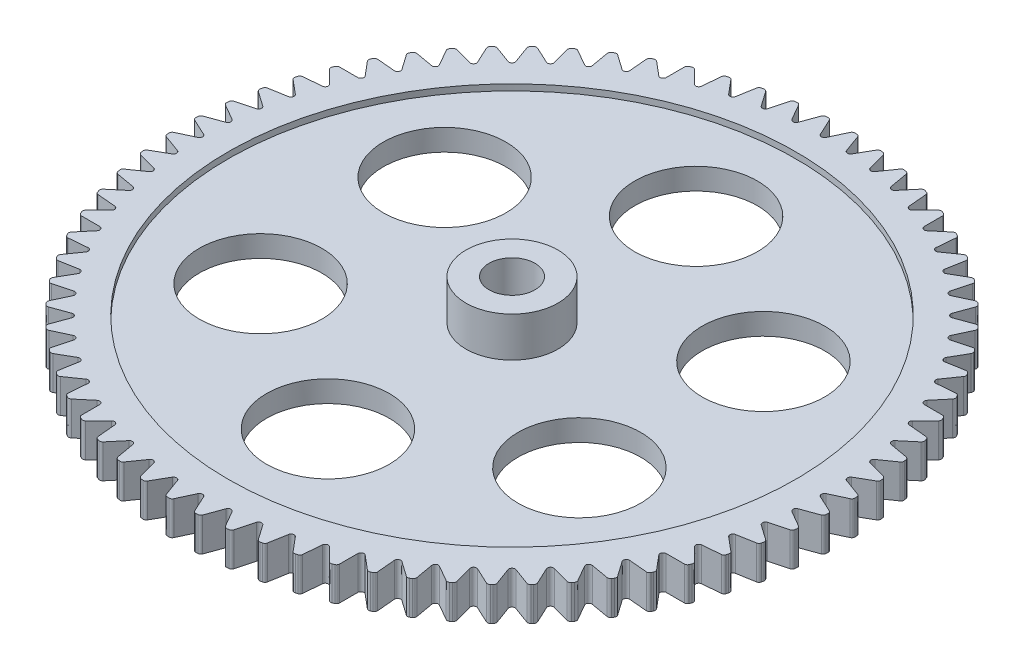
from build123d import *

# Parameters (mm, degrees)
CUT_EXTRUDE1_DEPTH = 16.321063932
FILLET1_R          = 0.1
CIRPATTERN1_START  = 0.8
CIRPATTERN1_DEPTH  = 1.1
SKETCH3_R          = 2
CUT_EXTRUDE2_DEPTH = 16.285192352
CIRPATTERN2_COUNT  = 6


# Read off the part's stored shape, not the designer's step: CirPattern1
with BuildPart() as part:
    # Sketch1 → Revolve1 (revolve)
    with BuildSketch(Plane.XY, mode=Mode.PRIVATE) as revolve1_sk:
        Polygon((0.5, 0), (0.5, 0.5), (0.75, 0.5), (0.75, 3), (1.5, 3), (1.5, 1.7), (9.25, 1.7), (9.25, 1.9), (10.75, 1.9), (10.75, 0.8), (9.25, 0.8), (9.25, 1), (1.5, 1), (1.5, 0), align=None)
    revolve(revolve1_sk.sketch.rotate(Axis((0, 55, 0), (0, -1, 0)), 90), axis=Axis((0, 55, 0), (0, -1, 0)))

    # Sketch2 → Cut-Extrude1 (cut, through all)
    with BuildSketch(Plane(origin=(0, 1.9, 0), x_dir=(1, 0, 0), z_dir=(0, 1, 0))):
        Polygon((-0.373046127, 10.75), (0, 9.95), (0.373046127, 10.75), align=None)
    extrude(amount=-CUT_EXTRUDE1_DEPTH, mode=Mode.SUBTRACT)

    # Fillet1
    fillet1_edges = [part.edges().sort_by_distance(p)[0] for p in [
        (0.370074857, 1.35, -10.743628093),
        (-0.370074857, 1.35, -10.743628093),
        (0, 1.35, -9.95),
    ]]
    fillet(fillet1_edges, radius=FILLET1_R)

    # CirPattern1 outline → CirPattern1 (cut)
    with BuildSketch(Plane(origin=(0, 0, 0), x_dir=(1, 0, 0), z_dir=(0, 1, 0)).offset(CIRPATTERN1_START)):
        with BuildLine():
            ThreePointArc((-7.947463997, -7.238806256), (-7.972392938, -7.186532724), (-7.964164878, -7.129206697))
            Line((-7.964164878, -7.129206697), (-7.712772988, -6.590095049))
            ThreePointArc((-7.712772988, -6.590095049), (-7.726799322, -6.483554461), (-7.829285671, -6.45124064))
            Line((-7.829285671, -6.45124064), (-8.403860746, -6.605197567))
            ThreePointArc((-8.403860746, -6.605197567), (-8.461744649, -6.603346064), (-8.508895164, -6.569718646))
            ThreePointArc((-8.508895164, -6.569718646), (-8.234977764, -6.909966804), (-7.947463997, -7.238806256))
        make_face()
        with BuildLine():
            ThreePointArc((1.271846931, 10.613006913), (1.314086242, 10.652627802), (1.371204865, 10.662190076))
            ThreePointArc((1.371204865, 10.662190076), (0.936924234, 10.709093004), (0.501096694, 10.738314677))
            ThreePointArc((0.501096694, 10.738314677), (0.555687086, 10.718979131), (0.590404592, 10.672625392))
            Line((0.590404592, 10.672625392), (0.793853184, 10.113654979))
            ThreePointArc((0.793853184, 10.113654979), (0.879106871, 10.048237523), (0.974424986, 10.097856993))
            Line((0.974424986, 10.097856993), (1.271846931, 10.613006913))
        make_face()
        with BuildLine():
            ThreePointArc((2.19199167, 10.461772453), (2.237523435, 10.497561175), (2.295258112, 10.502108845))
            ThreePointArc((2.295258112, 10.502108845), (1.86671791, 10.586683345), (1.435095662, 10.653778693))
            ThreePointArc((1.435095662, 10.653778693), (1.487793117, 10.629758858), (1.518338517, 10.58055568))
            Line((1.518338517, 10.58055568), (1.672295444, 10.005980604))
            ThreePointArc((1.672295444, 10.005980604), (1.75152321, 9.933381734), (1.850803232, 9.974504865))
            Line((1.850803232, 9.974504865), (2.19199167, 10.461772453))
        make_face()
        with BuildLine():
            ThreePointArc((3.095454028, 10.230917588), (3.143931724, 10.262601768), (3.201843059, 10.262100225))
            ThreePointArc((3.201843059, 10.262100225), (2.782304735, 10.383702632), (2.358172684, 10.48816102))
            ThreePointArc((2.358172684, 10.48816102), (2.408576143, 10.459639702), (2.43471697, 10.40796155))
            Line((2.43471697, 10.40796155), (2.538010527, 9.822154676))
            ThreePointArc((2.538010527, 9.822154676), (2.610609398, 9.742926911), (2.713095747, 9.775240733))
            Line((2.713095747, 9.775240733), (3.095454028, 10.230917588))
        make_face()
        with BuildLine():
            ThreePointArc((3.975358112, 9.922199263), (4.026412794, 9.949537766), (4.084060047, 9.943990825))
            ThreePointArc((4.084060047, 9.943990825), (3.676716541, 10.101695673), (3.263302589, 10.242722109))
            ThreePointArc((3.263302589, 10.242722109), (3.311028451, 10.209916373), (3.332565756, 10.156156548))
            Line((3.332565756, 10.156156548), (3.384409817, 9.563576219))
            ThreePointArc((3.384409817, 9.563576219), (3.449827272, 9.478322531), (3.554739965, 9.501581115))
            Line((3.554739965, 9.501581115), (3.975358112, 9.922199263))
        make_face()
        with BuildLine():
            ThreePointArc((4.825007321, 9.53796701), (4.878250432, 9.560751773), (4.935194872, 9.550201651))
            ThreePointArc((4.935194872, 9.550201651), (4.543146314, 9.74280871), (4.143596791, 9.919329898))
            ThreePointArc((4.143596791, 9.919329898), (4.188281833, 9.882489415), (4.205051704, 9.827057062))
            Line((4.205051704, 9.827057062), (4.205051704, 9.232213173))
            ThreePointArc((4.205051704, 9.232213173), (4.262789878, 9.141582394), (4.369330465, 9.155608729))
            Line((4.369330465, 9.155608729), (4.825007321, 9.53796701))
        make_face()
        with BuildLine():
            ThreePointArc((5.637935311, 9.08114507), (5.692961638, 9.099202686), (5.748769883, 9.083729676))
            ThreePointArc((5.748769883, 9.083729676), (5.375, 9.309773091), (4.992355719, 9.520445597))
            ThreePointArc((4.992355719, 9.520445597), (5.033659861, 9.479850745), (5.04553467, 9.423167739))
            Line((5.04553467, 9.423167739), (4.993690609, 8.83058741))
            ThreePointArc((4.993690609, 8.83058741), (5.043310079, 8.735269295), (5.150667723, 8.739956631))
            Line((5.150667723, 8.739956631), (5.637935311, 9.08114507))
        make_face()
        with BuildLine():
            ThreePointArc((6.407955208, 8.555210131), (6.464345969, 8.568403173), (6.518593285, 8.548125033))
            ThreePointArc((6.518593285, 8.548125033), (6.16594669, 8.805884476), (5.803119805, 9.049104957))
            ThreePointArc((5.803119805, 9.049104957), (5.840728699, 9.005064687), (5.847618071, 8.947562419))
            Line((5.847618071, 8.947562419), (5.744324514, 8.361755545))
            ThreePointArc((5.744324514, 8.361755545), (5.785447645, 8.262475523), (5.892805289, 8.257788187))
            Line((5.892805289, 8.257788187), (6.407955208, 8.555210131))
        make_face()
        with BuildLine():
            ThreePointArc((7.129206697, 7.964164878), (7.186532724, 7.972392938), (7.238806256, 7.947463997))
            ThreePointArc((7.238806256, 7.947463997), (6.909966804, 8.234977763), (6.569718646, 8.508895164))
            ThreePointArc((6.569718646, 8.508895164), (6.603346064, 8.461744649), (6.605197567, 8.403860746))
            Line((6.605197567, 8.403860746), (6.45124064, 7.829285671))
            ThreePointArc((6.45124064, 7.829285671), (6.483554461, 7.726799322), (6.590095049, 7.712772988))
            Line((6.590095049, 7.712772988), (7.129206697, 7.964164878))
        make_face()
        with BuildLine():
            ThreePointArc((7.796200619, 7.312507521), (7.854025625, 7.315707978), (7.903927541, 7.286317961))
            ThreePointArc((7.903927541, 7.286317961), (7.601397898, 7.601397898), (7.286317961, 7.903927541))
            ThreePointArc((7.286317961, 7.903927541), (7.315707978, 7.854025625), (7.312507521, 7.796200619))
            Line((7.312507521, 7.796200619), (7.109058929, 7.237230206))
            ThreePointArc((7.109058929, 7.237230206), (7.132317513, 7.132317513), (7.237230206, 7.109058929))
            Line((7.237230206, 7.109058929), (7.796200619, 7.312507521))
        make_face()
        with BuildLine():
            ThreePointArc((8.403860746, 6.605197567), (8.461744649, 6.603346064), (8.508895164, 6.569718646))
            ThreePointArc((8.508895164, 6.569718646), (8.234977763, 6.909966804), (7.947463997, 7.238806256))
            ThreePointArc((7.947463997, 7.238806256), (7.972392938, 7.186532724), (7.964164878, 7.129206697))
            Line((7.964164878, 7.129206697), (7.712772988, 6.590095049))
            ThreePointArc((7.712772988, 6.590095049), (7.726799322, 6.483554461), (7.829285671, 6.45124064))
            Line((7.829285671, 6.45124064), (8.403860746, 6.605197567))
        make_face()
        with BuildLine():
            ThreePointArc((8.947562419, 5.847618071), (9.005064687, 5.840728699), (9.049104957, 5.803119805))
            ThreePointArc((9.049104957, 5.803119805), (8.805884476, 6.16594669), (8.548125033, 6.518593285))
            ThreePointArc((8.548125033, 6.518593285), (8.568403173, 6.464345969), (8.555210131, 6.407955208))
            Line((8.555210131, 6.407955208), (8.257788187, 5.892805289))
            ThreePointArc((8.257788187, 5.892805289), (8.262475523, 5.785447645), (8.361755545, 5.744324514))
            Line((8.361755545, 5.744324514), (8.947562419, 5.847618071))
        make_face()
        with BuildLine():
            ThreePointArc((9.423167739, 5.04553467), (9.479850745, 5.033659861), (9.520445598, 4.992355719))
            ThreePointArc((9.520445598, 4.992355719), (9.309773091, 5.375), (9.083729676, 5.748769883))
            ThreePointArc((9.083729676, 5.748769883), (9.099202686, 5.692961638), (9.08114507, 5.637935311))
            Line((9.08114507, 5.637935311), (8.739956631, 5.150667723))
            ThreePointArc((8.739956631, 5.150667723), (8.735269295, 5.043310079), (8.83058741, 4.993690609))
            Line((8.83058741, 4.993690609), (9.423167739, 5.04553467))
        make_face()
        with BuildLine():
            ThreePointArc((9.827057062, 4.205051704), (9.882489415, 4.188281833), (9.919329899, 4.143596791))
            ThreePointArc((9.919329899, 4.143596791), (9.74280871, 4.543146314), (9.550201651, 4.935194872))
            ThreePointArc((9.550201651, 4.935194872), (9.560751773, 4.878250432), (9.53796701, 4.825007321))
            Line((9.53796701, 4.825007321), (9.155608729, 4.369330465))
            ThreePointArc((9.155608729, 4.369330465), (9.141582394, 4.262789878), (9.232213173, 4.205051704))
            Line((9.232213173, 4.205051704), (9.827057062, 4.205051704))
        make_face()
        with BuildLine():
            ThreePointArc((10.156156548, 3.332565756), (10.209916373, 3.311028451), (10.242722109, 3.263302589))
            ThreePointArc((10.242722109, 3.263302589), (10.101695673, 3.676716541), (9.943990825, 4.084060047))
            ThreePointArc((9.943990825, 4.084060047), (9.949537766, 4.026412794), (9.922199263, 3.975358112))
            Line((9.922199263, 3.975358112), (9.501581115, 3.554739965))
            ThreePointArc((9.501581115, 3.554739965), (9.478322531, 3.449827272), (9.563576219, 3.384409817))
            Line((9.563576219, 3.384409817), (10.156156548, 3.332565756))
        make_face()
        with BuildLine():
            ThreePointArc((10.40796155, 2.43471697), (10.459639702, 2.408576143), (10.48816102, 2.358172684))
            ThreePointArc((10.48816102, 2.358172684), (10.383702632, 2.782304735), (10.262100225, 3.201843059))
            ThreePointArc((10.262100225, 3.201843059), (10.262601768, 3.143931724), (10.230917588, 3.095454028))
            Line((10.230917588, 3.095454028), (9.775240733, 2.713095747))
            ThreePointArc((9.775240733, 2.713095747), (9.742926911, 2.610609398), (9.822154676, 2.538010527))
            Line((9.822154676, 2.538010527), (10.40796155, 2.43471697))
        make_face()
        with BuildLine():
            ThreePointArc((10.58055568, 1.518338517), (10.629758858, 1.487793117), (10.653778693, 1.435095662))
            ThreePointArc((10.653778693, 1.435095662), (10.586683345, 1.86671791), (10.502108845, 2.295258112))
            ThreePointArc((10.502108845, 2.295258112), (10.497561175, 2.237523435), (10.461772453, 2.19199167))
            Line((10.461772453, 2.19199167), (9.974504865, 1.850803232))
            ThreePointArc((9.974504865, 1.850803232), (9.933381734, 1.75152321), (10.005980604, 1.672295444))
            Line((10.005980604, 1.672295444), (10.58055568, 1.518338517))
        make_face()
        with BuildLine():
            ThreePointArc((10.672625392, 0.590404592), (10.718979131, 0.555687086), (10.738314677, 0.501096694))
            ThreePointArc((10.738314677, 0.501096694), (10.709093004, 0.936924234), (10.662190076, 1.371204865))
            ThreePointArc((10.662190076, 1.371204865), (10.652627802, 1.314086242), (10.613006913, 1.271846931))
            Line((10.613006913, 1.271846931), (10.097856993, 0.974424986))
            ThreePointArc((10.097856993, 0.974424986), (10.048237523, 0.879106871), (10.113654979, 0.793853184))
            Line((10.113654979, 0.793853184), (10.672625392, 0.590404592))
        make_face()
        with BuildLine():
            ThreePointArc((10.683469981, -0.342022669), (10.7266215, -0.380648058), (10.741125602, -0.436715922))
            ThreePointArc((10.741125602, -0.436715922), (10.75, 0), (10.741125602, 0.436715922))
            ThreePointArc((10.741125602, 0.436715922), (10.7266215, 0.380648058), (10.683469981, 0.342022669))
            Line((10.683469981, 0.342022669), (10.144358332, 0.090630779))
            ThreePointArc((10.144358332, 0.090630779), (10.086620158, 0), (10.144358332, -0.090630779))
            Line((10.144358332, -0.090630779), (10.683469981, -0.342022669))
        make_face()
        with BuildLine():
            ThreePointArc((10.613006913, -1.271846931), (10.652627802, -1.314086242), (10.662190076, -1.371204865))
            ThreePointArc((10.662190076, -1.371204865), (10.709093004, -0.936924234), (10.738314677, -0.501096694))
            ThreePointArc((10.738314677, -0.501096694), (10.718979131, -0.555687086), (10.672625392, -0.590404592))
            Line((10.672625392, -0.590404592), (10.113654979, -0.793853184))
            ThreePointArc((10.113654979, -0.793853184), (10.048237523, -0.879106871), (10.097856993, -0.974424986))
            Line((10.097856993, -0.974424986), (10.613006913, -1.271846931))
        make_face()
        with BuildLine():
            ThreePointArc((10.461772453, -2.19199167), (10.497561175, -2.237523435), (10.502108845, -2.295258112))
            ThreePointArc((10.502108845, -2.295258112), (10.586683345, -1.86671791), (10.653778693, -1.435095662))
            ThreePointArc((10.653778693, -1.435095662), (10.629758858, -1.487793117), (10.58055568, -1.518338517))
            Line((10.58055568, -1.518338517), (10.005980604, -1.672295444))
            ThreePointArc((10.005980604, -1.672295444), (9.933381734, -1.75152321), (9.974504865, -1.850803232))
            Line((9.974504865, -1.850803232), (10.461772453, -2.19199167))
        make_face()
        with BuildLine():
            ThreePointArc((10.230917588, -3.095454028), (10.262601768, -3.143931724), (10.262100225, -3.201843059))
            ThreePointArc((10.262100225, -3.201843059), (10.383702633, -2.782304735), (10.48816102, -2.358172684))
            ThreePointArc((10.48816102, -2.358172684), (10.459639702, -2.408576143), (10.40796155, -2.43471697))
            Line((10.40796155, -2.43471697), (9.822154676, -2.538010527))
            ThreePointArc((9.822154676, -2.538010527), (9.742926911, -2.610609398), (9.775240733, -2.713095747))
            Line((9.775240733, -2.713095747), (10.230917588, -3.095454028))
        make_face()
        with BuildLine():
            ThreePointArc((9.922199263, -3.975358112), (9.949537766, -4.026412794), (9.943990825, -4.084060047))
            ThreePointArc((9.943990825, -4.084060047), (10.101695673, -3.676716541), (10.242722109, -3.263302589))
            ThreePointArc((10.242722109, -3.263302589), (10.209916373, -3.311028451), (10.156156548, -3.332565756))
            Line((10.156156548, -3.332565756), (9.563576219, -3.384409817))
            ThreePointArc((9.563576219, -3.384409817), (9.478322531, -3.449827272), (9.501581115, -3.554739965))
            Line((9.501581115, -3.554739965), (9.922199263, -3.975358112))
        make_face()
        with BuildLine():
            ThreePointArc((9.53796701, -4.825007321), (9.560751773, -4.878250432), (9.550201651, -4.935194872))
            ThreePointArc((9.550201651, -4.935194872), (9.74280871, -4.543146314), (9.919329898, -4.143596791))
            ThreePointArc((9.919329898, -4.143596791), (9.882489415, -4.188281833), (9.827057062, -4.205051704))
            Line((9.827057062, -4.205051704), (9.232213173, -4.205051704))
            ThreePointArc((9.232213173, -4.205051704), (9.141582394, -4.262789878), (9.155608729, -4.369330465))
            Line((9.155608729, -4.369330465), (9.53796701, -4.825007321))
        make_face()
        with BuildLine():
            ThreePointArc((9.08114507, -5.637935311), (9.099202686, -5.692961638), (9.083729676, -5.748769883))
            ThreePointArc((9.083729676, -5.748769883), (9.309773091, -5.375), (9.520445598, -4.992355719))
            ThreePointArc((9.520445598, -4.992355719), (9.479850745, -5.033659861), (9.423167739, -5.04553467))
            Line((9.423167739, -5.04553467), (8.83058741, -4.993690609))
            ThreePointArc((8.83058741, -4.993690609), (8.735269295, -5.043310079), (8.739956631, -5.150667723))
            Line((8.739956631, -5.150667723), (9.08114507, -5.637935311))
        make_face()
        with BuildLine():
            ThreePointArc((8.555210131, -6.407955208), (8.568403173, -6.464345969), (8.548125033, -6.518593285))
            ThreePointArc((8.548125033, -6.518593285), (8.805884476, -6.165946691), (9.049104957, -5.803119805))
            ThreePointArc((9.049104957, -5.803119805), (9.005064687, -5.840728699), (8.947562419, -5.847618071))
            Line((8.947562419, -5.847618071), (8.361755545, -5.744324514))
            ThreePointArc((8.361755545, -5.744324514), (8.262475523, -5.785447645), (8.257788187, -5.892805289))
            Line((8.257788187, -5.892805289), (8.555210131, -6.407955208))
        make_face()
        with BuildLine():
            ThreePointArc((7.964164878, -7.129206697), (7.972392938, -7.186532724), (7.947463997, -7.238806256))
            ThreePointArc((7.947463997, -7.238806256), (8.234977764, -6.909966804), (8.508895164, -6.569718646))
            ThreePointArc((8.508895164, -6.569718646), (8.461744649, -6.603346064), (8.403860746, -6.605197567))
            Line((8.403860746, -6.605197567), (7.829285671, -6.45124064))
            ThreePointArc((7.829285671, -6.45124064), (7.726799322, -6.483554461), (7.712772988, -6.590095049))
            Line((7.712772988, -6.590095049), (7.964164878, -7.129206697))
        make_face()
        with BuildLine():
            ThreePointArc((7.312507521, -7.796200619), (7.315707978, -7.854025625), (7.286317961, -7.903927541))
            ThreePointArc((7.286317961, -7.903927541), (7.601397898, -7.601397898), (7.903927541, -7.286317961))
            ThreePointArc((7.903927541, -7.286317961), (7.854025625, -7.315707978), (7.796200619, -7.312507521))
            Line((7.796200619, -7.312507521), (7.237230206, -7.109058929))
            ThreePointArc((7.237230206, -7.109058929), (7.132317513, -7.132317513), (7.109058929, -7.237230206))
            Line((7.109058929, -7.237230206), (7.312507521, -7.796200619))
        make_face()
        with BuildLine():
            ThreePointArc((6.605197567, -8.403860746), (6.603346064, -8.461744649), (6.569718646, -8.508895164))
            ThreePointArc((6.569718646, -8.508895164), (6.909966804, -8.234977764), (7.238806256, -7.947463997))
            ThreePointArc((7.238806256, -7.947463997), (7.186532724, -7.972392938), (7.129206697, -7.964164878))
            Line((7.129206697, -7.964164878), (6.590095049, -7.712772988))
            ThreePointArc((6.590095049, -7.712772988), (6.483554461, -7.726799322), (6.45124064, -7.829285671))
            Line((6.45124064, -7.829285671), (6.605197567, -8.403860746))
        make_face()
        with BuildLine():
            ThreePointArc((5.847618071, -8.947562419), (5.840728699, -9.005064687), (5.803119805, -9.049104957))
            ThreePointArc((5.803119805, -9.049104957), (6.165946691, -8.805884476), (6.518593285, -8.548125033))
            ThreePointArc((6.518593285, -8.548125033), (6.464345969, -8.568403173), (6.407955208, -8.555210131))
            Line((6.407955208, -8.555210131), (5.892805289, -8.257788187))
            ThreePointArc((5.892805289, -8.257788187), (5.785447645, -8.262475523), (5.744324514, -8.361755545))
            Line((5.744324514, -8.361755545), (5.847618071, -8.947562419))
        make_face()
        with BuildLine():
            ThreePointArc((5.04553467, -9.423167739), (5.033659861, -9.479850745), (4.992355719, -9.520445598))
            ThreePointArc((4.992355719, -9.520445598), (5.375, -9.309773091), (5.748769883, -9.083729676))
            ThreePointArc((5.748769883, -9.083729676), (5.692961638, -9.099202686), (5.637935311, -9.08114507))
            Line((5.637935311, -9.08114507), (5.150667723, -8.739956631))
            ThreePointArc((5.150667723, -8.739956631), (5.043310079, -8.735269295), (4.993690609, -8.83058741))
            Line((4.993690609, -8.83058741), (5.04553467, -9.423167739))
        make_face()
        with BuildLine():
            ThreePointArc((4.205051704, -9.827057062), (4.188281833, -9.882489415), (4.143596791, -9.919329899))
            ThreePointArc((4.143596791, -9.919329899), (4.543146314, -9.742808711), (4.935194872, -9.550201651))
            ThreePointArc((4.935194872, -9.550201651), (4.878250432, -9.560751773), (4.825007321, -9.53796701))
            Line((4.825007321, -9.53796701), (4.369330465, -9.155608729))
            ThreePointArc((4.369330465, -9.155608729), (4.262789878, -9.141582394), (4.205051704, -9.232213173))
            Line((4.205051704, -9.232213173), (4.205051704, -9.827057062))
        make_face()
        with BuildLine():
            ThreePointArc((3.332565756, -10.156156548), (3.311028451, -10.209916373), (3.263302589, -10.242722109))
            ThreePointArc((3.263302589, -10.242722109), (3.676716541, -10.101695673), (4.084060047, -9.943990825))
            ThreePointArc((4.084060047, -9.943990825), (4.026412794, -9.949537766), (3.975358112, -9.922199263))
            Line((3.975358112, -9.922199263), (3.554739965, -9.501581115))
            ThreePointArc((3.554739965, -9.501581115), (3.449827272, -9.478322531), (3.384409817, -9.563576219))
            Line((3.384409817, -9.563576219), (3.332565756, -10.156156548))
        make_face()
        with BuildLine():
            ThreePointArc((2.43471697, -10.40796155), (2.408576143, -10.459639702), (2.358172684, -10.48816102))
            ThreePointArc((2.358172684, -10.48816102), (2.782304735, -10.383702633), (3.201843059, -10.262100225))
            ThreePointArc((3.201843059, -10.262100225), (3.143931724, -10.262601768), (3.095454028, -10.230917588))
            Line((3.095454028, -10.230917588), (2.713095747, -9.775240733))
            ThreePointArc((2.713095747, -9.775240733), (2.610609398, -9.742926911), (2.538010527, -9.822154676))
            Line((2.538010527, -9.822154676), (2.43471697, -10.40796155))
        make_face()
        with BuildLine():
            ThreePointArc((1.518338517, -10.58055568), (1.487793117, -10.629758858), (1.435095662, -10.653778693))
            ThreePointArc((1.435095662, -10.653778693), (1.86671791, -10.586683345), (2.295258112, -10.502108845))
            ThreePointArc((2.295258112, -10.502108845), (2.237523435, -10.497561175), (2.19199167, -10.461772453))
            Line((2.19199167, -10.461772453), (1.850803232, -9.974504865))
            ThreePointArc((1.850803232, -9.974504865), (1.75152321, -9.933381734), (1.672295444, -10.005980604))
            Line((1.672295444, -10.005980604), (1.518338517, -10.58055568))
        make_face()
        with BuildLine():
            ThreePointArc((0.590404592, -10.672625392), (0.555687086, -10.718979131), (0.501096694, -10.738314677))
            ThreePointArc((0.501096694, -10.738314677), (0.936924234, -10.709093005), (1.371204865, -10.662190076))
            ThreePointArc((1.371204865, -10.662190076), (1.314086242, -10.652627802), (1.271846931, -10.613006913))
            Line((1.271846931, -10.613006913), (0.974424986, -10.097856993))
            ThreePointArc((0.974424986, -10.097856993), (0.879106871, -10.048237523), (0.793853184, -10.113654979))
            Line((0.793853184, -10.113654979), (0.590404592, -10.672625392))
        make_face()
        with BuildLine():
            ThreePointArc((-0.342022669, -10.683469981), (-0.380648058, -10.7266215), (-0.436715922, -10.741125602))
            ThreePointArc((-0.436715922, -10.741125602), (0, -10.75), (0.436715922, -10.741125602))
            ThreePointArc((0.436715922, -10.741125602), (0.380648058, -10.7266215), (0.342022669, -10.683469981))
            Line((0.342022669, -10.683469981), (0.090630779, -10.144358332))
            ThreePointArc((0.090630779, -10.144358332), (0, -10.086620158), (-0.090630779, -10.144358332))
            Line((-0.090630779, -10.144358332), (-0.342022669, -10.683469981))
        make_face()
        with BuildLine():
            ThreePointArc((-1.271846931, -10.613006913), (-1.314086242, -10.652627802), (-1.371204865, -10.662190076))
            ThreePointArc((-1.371204865, -10.662190076), (-0.936924234, -10.709093005), (-0.501096694, -10.738314677))
            ThreePointArc((-0.501096694, -10.738314677), (-0.555687086, -10.718979131), (-0.590404592, -10.672625392))
            Line((-0.590404592, -10.672625392), (-0.793853184, -10.113654979))
            ThreePointArc((-0.793853184, -10.113654979), (-0.879106871, -10.048237523), (-0.974424986, -10.097856993))
            Line((-0.974424986, -10.097856993), (-1.271846931, -10.613006913))
        make_face()
        with BuildLine():
            ThreePointArc((-2.19199167, -10.461772453), (-2.237523435, -10.497561175), (-2.295258112, -10.502108845))
            ThreePointArc((-2.295258112, -10.502108845), (-1.86671791, -10.586683345), (-1.435095662, -10.653778693))
            ThreePointArc((-1.435095662, -10.653778693), (-1.487793117, -10.629758858), (-1.518338517, -10.58055568))
            Line((-1.518338517, -10.58055568), (-1.672295444, -10.005980604))
            ThreePointArc((-1.672295444, -10.005980604), (-1.75152321, -9.933381734), (-1.850803232, -9.974504865))
            Line((-1.850803232, -9.974504865), (-2.19199167, -10.461772453))
        make_face()
        with BuildLine():
            ThreePointArc((-3.095454028, -10.230917588), (-3.143931724, -10.262601768), (-3.201843059, -10.262100225))
            ThreePointArc((-3.201843059, -10.262100225), (-2.782304735, -10.383702633), (-2.358172684, -10.48816102))
            ThreePointArc((-2.358172684, -10.48816102), (-2.408576143, -10.459639702), (-2.43471697, -10.40796155))
            Line((-2.43471697, -10.40796155), (-2.538010527, -9.822154676))
            ThreePointArc((-2.538010527, -9.822154676), (-2.610609398, -9.742926911), (-2.713095747, -9.775240733))
            Line((-2.713095747, -9.775240733), (-3.095454028, -10.230917588))
        make_face()
        with BuildLine():
            ThreePointArc((-3.975358112, -9.922199263), (-4.026412794, -9.949537766), (-4.084060047, -9.943990825))
            ThreePointArc((-4.084060047, -9.943990825), (-3.676716541, -10.101695673), (-3.263302589, -10.242722109))
            ThreePointArc((-3.263302589, -10.242722109), (-3.311028451, -10.209916373), (-3.332565756, -10.156156548))
            Line((-3.332565756, -10.156156548), (-3.384409817, -9.563576219))
            ThreePointArc((-3.384409817, -9.563576219), (-3.449827272, -9.478322531), (-3.554739965, -9.501581115))
            Line((-3.554739965, -9.501581115), (-3.975358112, -9.922199263))
        make_face()
        with BuildLine():
            ThreePointArc((-4.825007321, -9.53796701), (-4.878250432, -9.560751773), (-4.935194872, -9.550201651))
            ThreePointArc((-4.935194872, -9.550201651), (-4.543146314, -9.742808711), (-4.143596791, -9.919329898))
            ThreePointArc((-4.143596791, -9.919329898), (-4.188281833, -9.882489415), (-4.205051704, -9.827057062))
            Line((-4.205051704, -9.827057062), (-4.205051704, -9.232213173))
            ThreePointArc((-4.205051704, -9.232213173), (-4.262789878, -9.141582394), (-4.369330465, -9.155608729))
            Line((-4.369330465, -9.155608729), (-4.825007321, -9.53796701))
        make_face()
        with BuildLine():
            ThreePointArc((-5.637935311, -9.08114507), (-5.692961638, -9.099202686), (-5.748769883, -9.083729676))
            ThreePointArc((-5.748769883, -9.083729676), (-5.375, -9.309773091), (-4.992355719, -9.520445598))
            ThreePointArc((-4.992355719, -9.520445598), (-5.033659861, -9.479850745), (-5.04553467, -9.423167739))
            Line((-5.04553467, -9.423167739), (-4.993690609, -8.83058741))
            ThreePointArc((-4.993690609, -8.83058741), (-5.043310079, -8.735269295), (-5.150667723, -8.739956631))
            Line((-5.150667723, -8.739956631), (-5.637935311, -9.08114507))
        make_face()
        with BuildLine():
            ThreePointArc((-6.407955208, -8.555210131), (-6.464345969, -8.568403173), (-6.518593285, -8.548125033))
            ThreePointArc((-6.518593285, -8.548125033), (-6.165946691, -8.805884476), (-5.803119805, -9.049104957))
            ThreePointArc((-5.803119805, -9.049104957), (-5.840728699, -9.005064687), (-5.847618071, -8.947562419))
            Line((-5.847618071, -8.947562419), (-5.744324514, -8.361755545))
            ThreePointArc((-5.744324514, -8.361755545), (-5.785447645, -8.262475523), (-5.892805289, -8.257788187))
            Line((-5.892805289, -8.257788187), (-6.407955208, -8.555210131))
        make_face()
        with BuildLine():
            ThreePointArc((-7.129206697, -7.964164878), (-7.186532724, -7.972392938), (-7.238806256, -7.947463997))
            ThreePointArc((-7.238806256, -7.947463997), (-6.909966804, -8.234977764), (-6.569718646, -8.508895164))
            ThreePointArc((-6.569718646, -8.508895164), (-6.603346064, -8.461744649), (-6.605197567, -8.403860746))
            Line((-6.605197567, -8.403860746), (-6.45124064, -7.829285671))
            ThreePointArc((-6.45124064, -7.829285671), (-6.483554461, -7.726799322), (-6.590095049, -7.712772988))
            Line((-6.590095049, -7.712772988), (-7.129206697, -7.964164878))
        make_face()
        with BuildLine():
            ThreePointArc((-7.796200619, -7.312507521), (-7.854025625, -7.315707978), (-7.903927541, -7.286317961))
            ThreePointArc((-7.903927541, -7.286317961), (-7.601397898, -7.601397898), (-7.286317961, -7.903927541))
            ThreePointArc((-7.286317961, -7.903927541), (-7.315707978, -7.854025625), (-7.312507521, -7.796200619))
            Line((-7.312507521, -7.796200619), (-7.109058929, -7.237230206))
            ThreePointArc((-7.109058929, -7.237230206), (-7.132317513, -7.132317513), (-7.237230206, -7.109058929))
            Line((-7.237230206, -7.109058929), (-7.796200619, -7.312507521))
        make_face()
        with BuildLine():
            ThreePointArc((-0.501096694, 10.738314677), (-0.936924234, 10.709093004), (-1.371204865, 10.662190076))
            ThreePointArc((-1.371204865, 10.662190076), (-1.314086242, 10.652627802), (-1.271846931, 10.613006913))
            Line((-1.271846931, 10.613006913), (-0.974424986, 10.097856993))
            ThreePointArc((-0.974424986, 10.097856993), (-0.879106871, 10.048237523), (-0.793853184, 10.113654979))
            Line((-0.793853184, 10.113654979), (-0.590404592, 10.672625392))
            ThreePointArc((-0.590404592, 10.672625392), (-0.555687086, 10.718979131), (-0.501096694, 10.738314677))
        make_face()
        with BuildLine():
            ThreePointArc((-1.435095662, 10.653778693), (-1.86671791, 10.586683345), (-2.295258112, 10.502108845))
            ThreePointArc((-2.295258112, 10.502108845), (-2.237523435, 10.497561175), (-2.19199167, 10.461772453))
            Line((-2.19199167, 10.461772453), (-1.850803232, 9.974504865))
            ThreePointArc((-1.850803232, 9.974504865), (-1.75152321, 9.933381734), (-1.672295444, 10.005980604))
            Line((-1.672295444, 10.005980604), (-1.518338517, 10.58055568))
            ThreePointArc((-1.518338517, 10.58055568), (-1.487793117, 10.629758858), (-1.435095662, 10.653778693))
        make_face()
        with BuildLine():
            ThreePointArc((-2.358172684, 10.48816102), (-2.782304735, 10.383702632), (-3.201843059, 10.262100225))
            ThreePointArc((-3.201843059, 10.262100225), (-3.143931724, 10.262601768), (-3.095454028, 10.230917588))
            Line((-3.095454028, 10.230917588), (-2.713095747, 9.775240733))
            ThreePointArc((-2.713095747, 9.775240733), (-2.610609398, 9.742926911), (-2.538010527, 9.822154676))
            Line((-2.538010527, 9.822154676), (-2.43471697, 10.40796155))
            ThreePointArc((-2.43471697, 10.40796155), (-2.408576143, 10.459639702), (-2.358172684, 10.48816102))
        make_face()
        with BuildLine():
            ThreePointArc((-3.263302589, 10.242722109), (-3.676716541, 10.101695673), (-4.084060047, 9.943990825))
            ThreePointArc((-4.084060047, 9.943990825), (-4.026412794, 9.949537766), (-3.975358112, 9.922199263))
            Line((-3.975358112, 9.922199263), (-3.554739965, 9.501581115))
            ThreePointArc((-3.554739965, 9.501581115), (-3.449827272, 9.478322531), (-3.384409817, 9.563576219))
            Line((-3.384409817, 9.563576219), (-3.332565756, 10.156156548))
            ThreePointArc((-3.332565756, 10.156156548), (-3.311028451, 10.209916373), (-3.263302589, 10.242722109))
        make_face()
        with BuildLine():
            ThreePointArc((-4.143596791, 9.919329898), (-4.543146314, 9.74280871), (-4.935194872, 9.550201651))
            ThreePointArc((-4.935194872, 9.550201651), (-4.878250432, 9.560751773), (-4.825007321, 9.53796701))
            Line((-4.825007321, 9.53796701), (-4.369330465, 9.155608729))
            ThreePointArc((-4.369330465, 9.155608729), (-4.262789878, 9.141582394), (-4.205051704, 9.232213173))
            Line((-4.205051704, 9.232213173), (-4.205051704, 9.827057062))
            ThreePointArc((-4.205051704, 9.827057062), (-4.188281833, 9.882489415), (-4.143596791, 9.919329898))
        make_face()
        with BuildLine():
            ThreePointArc((-4.992355719, 9.520445597), (-5.375, 9.309773091), (-5.748769883, 9.083729676))
            ThreePointArc((-5.748769883, 9.083729676), (-5.692961638, 9.099202686), (-5.637935311, 9.08114507))
            Line((-5.637935311, 9.08114507), (-5.150667723, 8.739956631))
            ThreePointArc((-5.150667723, 8.739956631), (-5.043310079, 8.735269295), (-4.993690609, 8.83058741))
            Line((-4.993690609, 8.83058741), (-5.04553467, 9.423167739))
            ThreePointArc((-5.04553467, 9.423167739), (-5.033659861, 9.479850745), (-4.992355719, 9.520445597))
        make_face()
        with BuildLine():
            ThreePointArc((-5.803119805, 9.049104957), (-6.16594669, 8.805884476), (-6.518593285, 8.548125033))
            ThreePointArc((-6.518593285, 8.548125033), (-6.464345969, 8.568403173), (-6.407955208, 8.555210131))
            Line((-6.407955208, 8.555210131), (-5.892805289, 8.257788187))
            ThreePointArc((-5.892805289, 8.257788187), (-5.785447645, 8.262475523), (-5.744324514, 8.361755545))
            Line((-5.744324514, 8.361755545), (-5.847618071, 8.947562419))
            ThreePointArc((-5.847618071, 8.947562419), (-5.840728699, 9.005064687), (-5.803119805, 9.049104957))
        make_face()
        with BuildLine():
            ThreePointArc((-6.569718646, 8.508895164), (-6.909966804, 8.234977763), (-7.238806256, 7.947463997))
            ThreePointArc((-7.238806256, 7.947463997), (-7.186532724, 7.972392938), (-7.129206697, 7.964164878))
            Line((-7.129206697, 7.964164878), (-6.590095049, 7.712772988))
            ThreePointArc((-6.590095049, 7.712772988), (-6.483554461, 7.726799322), (-6.45124064, 7.829285671))
            Line((-6.45124064, 7.829285671), (-6.605197567, 8.403860746))
            ThreePointArc((-6.605197567, 8.403860746), (-6.603346064, 8.461744649), (-6.569718646, 8.508895164))
        make_face()
        with BuildLine():
            ThreePointArc((-7.286317961, 7.903927541), (-7.601397898, 7.601397898), (-7.903927541, 7.286317961))
            ThreePointArc((-7.903927541, 7.286317961), (-7.854025625, 7.315707978), (-7.796200619, 7.312507521))
            Line((-7.796200619, 7.312507521), (-7.237230206, 7.109058929))
            ThreePointArc((-7.237230206, 7.109058929), (-7.132317513, 7.132317513), (-7.109058929, 7.237230206))
            Line((-7.109058929, 7.237230206), (-7.312507521, 7.796200619))
            ThreePointArc((-7.312507521, 7.796200619), (-7.315707978, 7.854025625), (-7.286317961, 7.903927541))
        make_face()
        with BuildLine():
            ThreePointArc((-7.947463997, 7.238806256), (-8.234977763, 6.909966804), (-8.508895164, 6.569718646))
            ThreePointArc((-8.508895164, 6.569718646), (-8.461744649, 6.603346064), (-8.403860746, 6.605197567))
            Line((-8.403860746, 6.605197567), (-7.829285671, 6.45124064))
            ThreePointArc((-7.829285671, 6.45124064), (-7.726799322, 6.483554461), (-7.712772988, 6.590095049))
            Line((-7.712772988, 6.590095049), (-7.964164878, 7.129206697))
            ThreePointArc((-7.964164878, 7.129206697), (-7.972392938, 7.186532724), (-7.947463997, 7.238806256))
        make_face()
        with BuildLine():
            ThreePointArc((-8.548125033, 6.518593285), (-8.805884476, 6.16594669), (-9.049104957, 5.803119805))
            ThreePointArc((-9.049104957, 5.803119805), (-9.005064687, 5.840728699), (-8.947562419, 5.847618071))
            Line((-8.947562419, 5.847618071), (-8.361755545, 5.744324514))
            ThreePointArc((-8.361755545, 5.744324514), (-8.262475523, 5.785447645), (-8.257788187, 5.892805289))
            Line((-8.257788187, 5.892805289), (-8.555210131, 6.407955208))
            ThreePointArc((-8.555210131, 6.407955208), (-8.568403173, 6.464345969), (-8.548125033, 6.518593285))
        make_face()
        with BuildLine():
            ThreePointArc((-9.083729676, 5.748769883), (-9.309773091, 5.375), (-9.520445597, 4.992355719))
            ThreePointArc((-9.520445597, 4.992355719), (-9.479850745, 5.033659861), (-9.423167739, 5.04553467))
            Line((-9.423167739, 5.04553467), (-8.83058741, 4.993690609))
            ThreePointArc((-8.83058741, 4.993690609), (-8.735269295, 5.043310079), (-8.739956631, 5.150667723))
            Line((-8.739956631, 5.150667723), (-9.08114507, 5.637935311))
            ThreePointArc((-9.08114507, 5.637935311), (-9.099202686, 5.692961638), (-9.083729676, 5.748769883))
        make_face()
        with BuildLine():
            ThreePointArc((-9.550201651, 4.935194872), (-9.74280871, 4.543146314), (-9.919329898, 4.143596791))
            ThreePointArc((-9.919329898, 4.143596791), (-9.882489415, 4.188281833), (-9.827057062, 4.205051704))
            Line((-9.827057062, 4.205051704), (-9.232213173, 4.205051704))
            ThreePointArc((-9.232213173, 4.205051704), (-9.141582394, 4.262789878), (-9.155608729, 4.369330465))
            Line((-9.155608729, 4.369330465), (-9.53796701, 4.825007321))
            ThreePointArc((-9.53796701, 4.825007321), (-9.560751773, 4.878250432), (-9.550201651, 4.935194872))
        make_face()
        with BuildLine():
            ThreePointArc((-9.943990825, 4.084060047), (-10.101695673, 3.676716541), (-10.242722109, 3.263302589))
            ThreePointArc((-10.242722109, 3.263302589), (-10.209916373, 3.311028451), (-10.156156548, 3.332565756))
            Line((-10.156156548, 3.332565756), (-9.563576219, 3.384409817))
            ThreePointArc((-9.563576219, 3.384409817), (-9.478322531, 3.449827272), (-9.501581115, 3.554739965))
            Line((-9.501581115, 3.554739965), (-9.922199263, 3.975358112))
            ThreePointArc((-9.922199263, 3.975358112), (-9.949537766, 4.026412794), (-9.943990825, 4.084060047))
        make_face()
        with BuildLine():
            ThreePointArc((-10.262100225, 3.201843059), (-10.383702632, 2.782304735), (-10.48816102, 2.358172684))
            ThreePointArc((-10.48816102, 2.358172684), (-10.459639702, 2.408576143), (-10.40796155, 2.43471697))
            Line((-10.40796155, 2.43471697), (-9.822154676, 2.538010527))
            ThreePointArc((-9.822154676, 2.538010527), (-9.742926911, 2.610609398), (-9.775240733, 2.713095747))
            Line((-9.775240733, 2.713095747), (-10.230917588, 3.095454028))
            ThreePointArc((-10.230917588, 3.095454028), (-10.262601768, 3.143931724), (-10.262100225, 3.201843059))
        make_face()
        with BuildLine():
            ThreePointArc((-10.502108845, 2.295258112), (-10.586683345, 1.86671791), (-10.653778693, 1.435095662))
            ThreePointArc((-10.653778693, 1.435095662), (-10.629758858, 1.487793117), (-10.58055568, 1.518338517))
            Line((-10.58055568, 1.518338517), (-10.005980604, 1.672295444))
            ThreePointArc((-10.005980604, 1.672295444), (-9.933381734, 1.75152321), (-9.974504865, 1.850803232))
            Line((-9.974504865, 1.850803232), (-10.461772453, 2.19199167))
            ThreePointArc((-10.461772453, 2.19199167), (-10.497561175, 2.237523435), (-10.502108845, 2.295258112))
        make_face()
        with BuildLine():
            ThreePointArc((-10.662190076, 1.371204865), (-10.709093004, 0.936924234), (-10.738314677, 0.501096694))
            ThreePointArc((-10.738314677, 0.501096694), (-10.718979131, 0.555687086), (-10.672625392, 0.590404592))
            Line((-10.672625392, 0.590404592), (-10.113654979, 0.793853184))
            ThreePointArc((-10.113654979, 0.793853184), (-10.048237523, 0.879106871), (-10.097856993, 0.974424986))
            Line((-10.097856993, 0.974424986), (-10.613006913, 1.271846931))
            ThreePointArc((-10.613006913, 1.271846931), (-10.652627802, 1.314086242), (-10.662190076, 1.371204865))
        make_face()
        with BuildLine():
            ThreePointArc((-10.741125602, 0.436715922), (-10.75, 0), (-10.741125602, -0.436715922))
            ThreePointArc((-10.741125602, -0.436715922), (-10.7266215, -0.380648058), (-10.683469981, -0.342022669))
            Line((-10.683469981, -0.342022669), (-10.144358332, -0.090630779))
            ThreePointArc((-10.144358332, -0.090630779), (-10.086620158, 0), (-10.144358332, 0.090630779))
            Line((-10.144358332, 0.090630779), (-10.683469981, 0.342022669))
            ThreePointArc((-10.683469981, 0.342022669), (-10.7266215, 0.380648058), (-10.741125602, 0.436715922))
        make_face()
        with BuildLine():
            ThreePointArc((-10.738314677, -0.501096694), (-10.709093004, -0.936924234), (-10.662190076, -1.371204865))
            ThreePointArc((-10.662190076, -1.371204865), (-10.652627802, -1.314086242), (-10.613006913, -1.271846931))
            Line((-10.613006913, -1.271846931), (-10.097856993, -0.974424986))
            ThreePointArc((-10.097856993, -0.974424986), (-10.048237523, -0.879106871), (-10.113654979, -0.793853184))
            Line((-10.113654979, -0.793853184), (-10.672625392, -0.590404592))
            ThreePointArc((-10.672625392, -0.590404592), (-10.718979131, -0.555687086), (-10.738314677, -0.501096694))
        make_face()
        with BuildLine():
            ThreePointArc((-10.653778693, -1.435095662), (-10.586683345, -1.86671791), (-10.502108845, -2.295258112))
            ThreePointArc((-10.502108845, -2.295258112), (-10.497561175, -2.237523435), (-10.461772453, -2.19199167))
            Line((-10.461772453, -2.19199167), (-9.974504865, -1.850803232))
            ThreePointArc((-9.974504865, -1.850803232), (-9.933381734, -1.75152321), (-10.005980604, -1.672295444))
            Line((-10.005980604, -1.672295444), (-10.58055568, -1.518338517))
            ThreePointArc((-10.58055568, -1.518338517), (-10.629758858, -1.487793117), (-10.653778693, -1.435095662))
        make_face()
        with BuildLine():
            ThreePointArc((-10.48816102, -2.358172684), (-10.383702633, -2.782304735), (-10.262100225, -3.201843059))
            ThreePointArc((-10.262100225, -3.201843059), (-10.262601768, -3.143931724), (-10.230917588, -3.095454028))
            Line((-10.230917588, -3.095454028), (-9.775240733, -2.713095747))
            ThreePointArc((-9.775240733, -2.713095747), (-9.742926911, -2.610609398), (-9.822154676, -2.538010527))
            Line((-9.822154676, -2.538010527), (-10.40796155, -2.43471697))
            ThreePointArc((-10.40796155, -2.43471697), (-10.459639702, -2.408576143), (-10.48816102, -2.358172684))
        make_face()
        with BuildLine():
            ThreePointArc((-10.242722109, -3.263302589), (-10.101695673, -3.676716541), (-9.943990825, -4.084060047))
            ThreePointArc((-9.943990825, -4.084060047), (-9.949537766, -4.026412794), (-9.922199263, -3.975358112))
            Line((-9.922199263, -3.975358112), (-9.501581115, -3.554739965))
            ThreePointArc((-9.501581115, -3.554739965), (-9.478322531, -3.449827272), (-9.563576219, -3.384409817))
            Line((-9.563576219, -3.384409817), (-10.156156548, -3.332565756))
            ThreePointArc((-10.156156548, -3.332565756), (-10.209916373, -3.311028451), (-10.242722109, -3.263302589))
        make_face()
        with BuildLine():
            ThreePointArc((-9.919329898, -4.143596791), (-9.74280871, -4.543146314), (-9.550201651, -4.935194872))
            ThreePointArc((-9.550201651, -4.935194872), (-9.560751773, -4.878250432), (-9.53796701, -4.825007321))
            Line((-9.53796701, -4.825007321), (-9.155608729, -4.369330465))
            ThreePointArc((-9.155608729, -4.369330465), (-9.141582394, -4.262789878), (-9.232213173, -4.205051704))
            Line((-9.232213173, -4.205051704), (-9.827057062, -4.205051704))
            ThreePointArc((-9.827057062, -4.205051704), (-9.882489415, -4.188281833), (-9.919329898, -4.143596791))
        make_face()
        with BuildLine():
            ThreePointArc((-9.520445598, -4.992355719), (-9.309773091, -5.375), (-9.083729676, -5.748769883))
            ThreePointArc((-9.083729676, -5.748769883), (-9.099202686, -5.692961638), (-9.08114507, -5.637935311))
            Line((-9.08114507, -5.637935311), (-8.739956631, -5.150667723))
            ThreePointArc((-8.739956631, -5.150667723), (-8.735269295, -5.043310079), (-8.83058741, -4.993690609))
            Line((-8.83058741, -4.993690609), (-9.423167739, -5.04553467))
            ThreePointArc((-9.423167739, -5.04553467), (-9.479850745, -5.033659861), (-9.520445598, -4.992355719))
        make_face()
        with BuildLine():
            ThreePointArc((-9.049104957, -5.803119805), (-8.805884476, -6.165946691), (-8.548125033, -6.518593285))
            ThreePointArc((-8.548125033, -6.518593285), (-8.568403173, -6.464345969), (-8.555210131, -6.407955208))
            Line((-8.555210131, -6.407955208), (-8.257788187, -5.892805289))
            ThreePointArc((-8.257788187, -5.892805289), (-8.262475523, -5.785447645), (-8.361755545, -5.744324514))
            Line((-8.361755545, -5.744324514), (-8.947562419, -5.847618071))
            ThreePointArc((-8.947562419, -5.847618071), (-9.005064687, -5.840728699), (-9.049104957, -5.803119805))
        make_face()
    extrude(amount=CIRPATTERN1_DEPTH, mode=Mode.SUBTRACT)

    # Sketch3 → Cut-Extrude2 (cut, through all)
    with BuildSketch(Plane(origin=(0, 1.7, 0), x_dir=(1, 0, 0), z_dir=(0, 1, 0))):
        with Locations(Location((0, 6, 0), (0, 0, 270))):
            Circle(SKETCH3_R)
    cut_extrude2 = extrude(amount=-CUT_EXTRUDE2_DEPTH, mode=Mode.SUBTRACT)

    # CirPattern2: Cut-Extrude2 ×6 about axis
    cirpattern2_axis = Axis((0, 0, 0), (0, 1, 0))
    for i in range(1, CIRPATTERN2_COUNT):
        add(cut_extrude2.rotate(cirpattern2_axis, i * 360 / CIRPATTERN2_COUNT), mode=Mode.SUBTRACT)


solid = part.part
